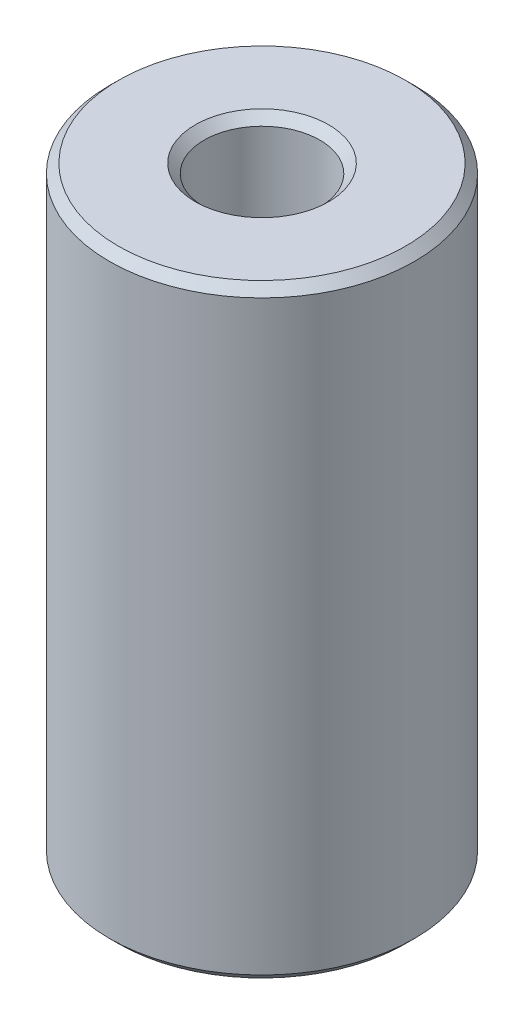
from build123d import *

# Parameters (mm, degrees)
SKETCH1_R           = 5
BOSS_EXTRUDE1_DEPTH = 19.808407926
SKETCH2_R           = 1.897920877
CUT_EXTRUDE1_DEPTH  = 22.032665655
CHAMFER1_SIZE       = 0.289866619


with BuildPart() as part:
    # Sketch1 → Boss-Extrude1 (new body)
    with BuildSketch(Plane(origin=(0, 0, 0), x_dir=(1, 0, 0), z_dir=(0, 1, 0))):
        Circle(SKETCH1_R)
    extrude(amount=BOSS_EXTRUDE1_DEPTH)

    # Sketch2 → Cut-Extrude1 (cut, through all)
    with BuildSketch(Plane(origin=(0, 0, 0), x_dir=(1, 0, 0), z_dir=(0, 1, 0))):
        Circle(SKETCH2_R)
    extrude(amount=CUT_EXTRUDE1_DEPTH, mode=Mode.SUBTRACT)

    # Chamfer1
    chamfer1_edges = [part.edges().sort_by_distance(p)[0] for p in [
        (-1.897920877, 19.808407926, 0),
        (-1.897920877, 0, 0),
        (-5, 0, 0),
        (-5, 19.808407926, 0),
    ]]
    chamfer(chamfer1_edges, length=CHAMFER1_SIZE)


solid = part.part
